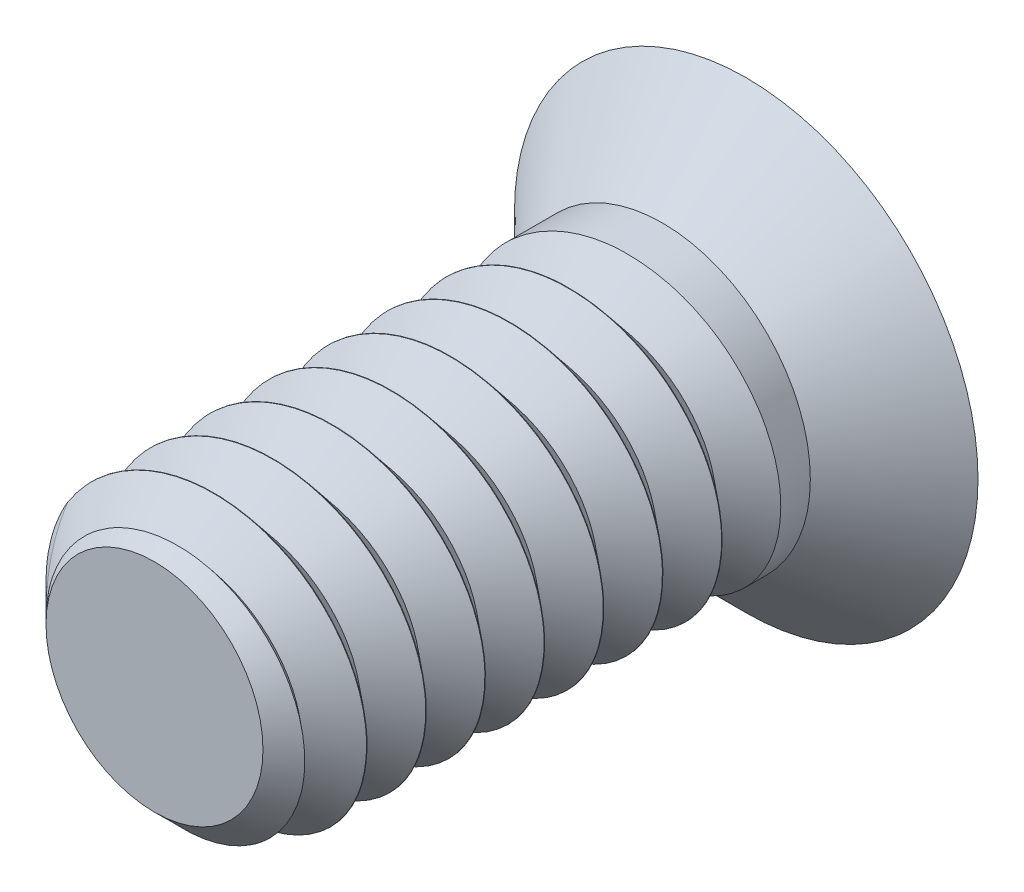
from build123d import *

# Parameters (mm, degrees)
SKETCH1_R           = 3
BOSS_EXTRUDE1_DEPTH = 10
CHAMFER3_SIZE       = 0.8
CUT_SWEEP3_PITCH    = 1.2
SKETCH5_R           = 4.9
BOSS_EXTRUDE2_DEPTH = 2
CUT_EXTRUDE1_DEPTH  = 3
CHAMFER2_SIZE       = 2.2


with BuildPart() as part:
    # Sketch1 → Boss-Extrude1 (new body)
    with BuildSketch(Plane.XY):
        Circle(SKETCH1_R)
    extrude(amount=BOSS_EXTRUDE1_DEPTH)

    # Chamfer3
    chamfer3_edges = [part.edges().sort_by_distance(p)[0] for p in [
        (-3, 0, 10),
    ]]
    chamfer(chamfer3_edges, length=CHAMFER3_SIZE)

    # Cut-Sweep3: the profile of Sketch3 profile screwed along a right-hand helix of 29.166667 turns, 8 arcs to a turn; built about Z, then put on its axis
    cut_sweep3_z = Axis((0, 0, 0), (0, 0, 1))
    cut_sweep3_corners = [(3.0003, 0, 0.595247917), (3.0003, 0, -0.595247917), (2.28, 0, 0)]
    with BuildLine(mode=Mode.PRIVATE) as cut_sweep3_profile:
        Line(cut_sweep3_corners[0], cut_sweep3_corners[1])
        Line(cut_sweep3_corners[1], cut_sweep3_corners[2])
        Line(cut_sweep3_corners[2], cut_sweep3_corners[0])
    cut_sweep3_cap = Face(cut_sweep3_profile.wire())
    cut_sweep3_turn_angles = [0, 22.5, 45, 67.5, 90, 112.5, 135, 157.5, 180, 202.5, 225, 247.5, 270, 292.5, 315, 337.5, 360]
    cut_sweep3_turn_weights = [1, 0.9238795325112867, 1, 0.9238795325112867, 1, 0.9238795325112867, 1, 0.9238795325112867, 1, 0.9238795325112867, 1, 0.9238795325112867, 1, 0.9238795325112867, 1, 0.9238795325112867, 1]
    cut_sweep3_turn_rails = [Edge.make_bspline([Vector(p[0], p[1], 0).rotate(cut_sweep3_z, cut_sweep3_turn_angles[k]) / cut_sweep3_turn_weights[k] + Vector(0, 0, p[2] + CUT_SWEEP3_PITCH * cut_sweep3_turn_angles[k] / 360) for k in range(17)], [0, 0, 0, 1, 1, 2, 2, 3, 3, 4, 4, 5, 5, 6, 6, 7, 7, 8, 8, 8], 2, cut_sweep3_turn_weights) for p in cut_sweep3_corners]
    cut_sweep3_turn_sides = [Face.make_surface_from_curves(cut_sweep3_turn_rails[p[0]], cut_sweep3_turn_rails[p[1]]) for p in [(0, 1), (1, 2), (2, 0)]]
    cut_sweep3_last_angles = [10440, 10462.5, 10485, 10492.5, 10500]
    cut_sweep3_last_weights = [1, 0.9238795325112867, 1, 0.9914448613738477, 1]
    cut_sweep3_last_rails = [Edge.make_bspline([Vector(p[0], p[1], 0).rotate(cut_sweep3_z, cut_sweep3_last_angles[k]) / cut_sweep3_last_weights[k] + Vector(0, 0, p[2] + CUT_SWEEP3_PITCH * cut_sweep3_last_angles[k] / 360) for k in range(5)], [0, 0, 0, 1, 1, 2, 2, 2], 2, cut_sweep3_last_weights) for p in cut_sweep3_corners]
    cut_sweep3_last_sides = [Face.make_surface_from_curves(cut_sweep3_last_rails[p[0]], cut_sweep3_last_rails[p[1]]) for p in [(0, 1), (1, 2), (2, 0)]]
    cut_sweep3 = Plane(origin=(0, 0, 0.6), x_dir=(0, -1, 0), z_dir=(0, 0, 1)) * Solid(Shell([*[p.moved(Location((0, 0, CUT_SWEEP3_PITCH * i))) for i in range(29) for p in cut_sweep3_turn_sides], *cut_sweep3_last_sides, cut_sweep3_cap, cut_sweep3_cap.rotate(cut_sweep3_z, 10500).moved(Location((0, 0, CUT_SWEEP3_PITCH * 10500 / 360)))]))
    add(cut_sweep3, mode=Mode.SUBTRACT)

    # Sketch5 → Boss-Extrude2 (add)
    with BuildSketch(Plane(origin=(0, 0, 0), x_dir=(-1, 0, 0), z_dir=(0, 0, -1))):
        Circle(SKETCH5_R)
    extrude(amount=BOSS_EXTRUDE2_DEPTH)

    # Sketch4 → Cut-Extrude1 (cut)
    with BuildSketch(Plane(origin=(0, 0, -2), x_dir=(-1, 0, 0), z_dir=(0, 0, -1))):
        Polygon((0.5, 2), (-0.5, 2), (-0.5, 0.5), (-2, 0.5), (-2, -0.5), (-0.5, -0.5), (-0.5, -2), (0.5, -2), (0.5, -0.5), (2, -0.5), (2, 0.5), (0.5, 0.5), align=None)
    extrude(amount=-CUT_EXTRUDE1_DEPTH, mode=Mode.SUBTRACT)

    # Chamfer2
    # the kernel refuses this chamfer: 2.2 mm, written as the material it takes off along each edge
    with BuildSketch(Plane(origin=(0, 0, 0), x_dir=(-1, 0, 0), z_dir=(0, -1, 0))) as chamfer2_piece_1_section:
        Polygon((4.9, CHAMFER2_SIZE), (4.9 - CHAMFER2_SIZE, 0), (4.9, 0), align=None)
    chamfer2_piece_1 = revolve(axis=Axis((0, 0, 0), (0, 0, -1)), mode=Mode.PRIVATE)
    chamfer2_piece_1 = chamfer2_piece_1 - Plane(origin=(0, 0, -1.252184491), x_dir=(1, 0, 0), z_dir=(0, 0, -1)) * Cylinder(3, 20, mode=Mode.PRIVATE)
    add(chamfer2_piece_1, mode=Mode.SUBTRACT)


solid = part.part
